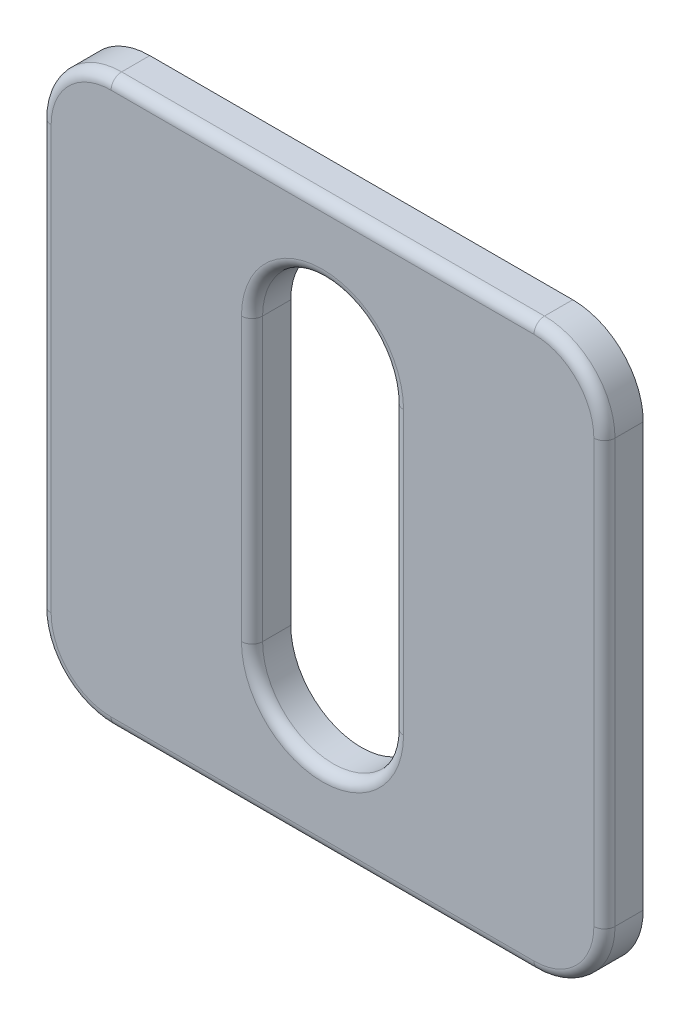
from build123d import *

# Parameters (mm, degrees)
SKETCH1_W           = 40
SKETCH1_H           = 40
BOSS_EXTRUDE1_DEPTH = 2.75
FILLET1_R           = 5
FILLET2_R           = 0.75


with BuildPart() as part:
    # Sketch1 → Boss-Extrude1 (new body)
    with BuildSketch(Plane.XY):
        with Locations((20, 20)):
            Rectangle(SKETCH1_W, SKETCH1_H)
        with BuildLine():
            Line((25, 30), (25, 10))
            ThreePointArc((25, 10), (20, 5), (15, 10))
            Line((15, 10), (15, 30))
            ThreePointArc((15, 30), (20, 35), (25, 30))
        make_face(mode=Mode.SUBTRACT)
    extrude(amount=BOSS_EXTRUDE1_DEPTH)

    # Fillet1
    fillet1_edges = [part.edges().sort_by_distance(p)[0] for p in [
        (40, 40, 1.375),
        (40, 0, 1.375),
        (0, 0, 1.375),
        (0, 40, 1.375),
    ]]
    fillet(fillet1_edges, radius=FILLET1_R)

    # Fillet2
    fillet2_edges = [part.edges().sort_by_distance(p)[0] for p in [
        (1.464466094, 1.464466094, 2.75),
        (0, 20, 2.75),
        (1.464466094, 38.535533906, 2.75),
        (38.535533906, 38.535533906, 2.75),
        (20, 40, 2.75),
        (40, 20, 2.75),
        (38.535533906, 1.464466094, 2.75),
        (20, 0, 2.75),
        (20, 5, 2.75),
        (25, 20, 2.75),
        (20, 35, 2.75),
        (15, 20, 2.75),
    ]]
    fillet(fillet2_edges, radius=FILLET2_R)


solid = part.part
